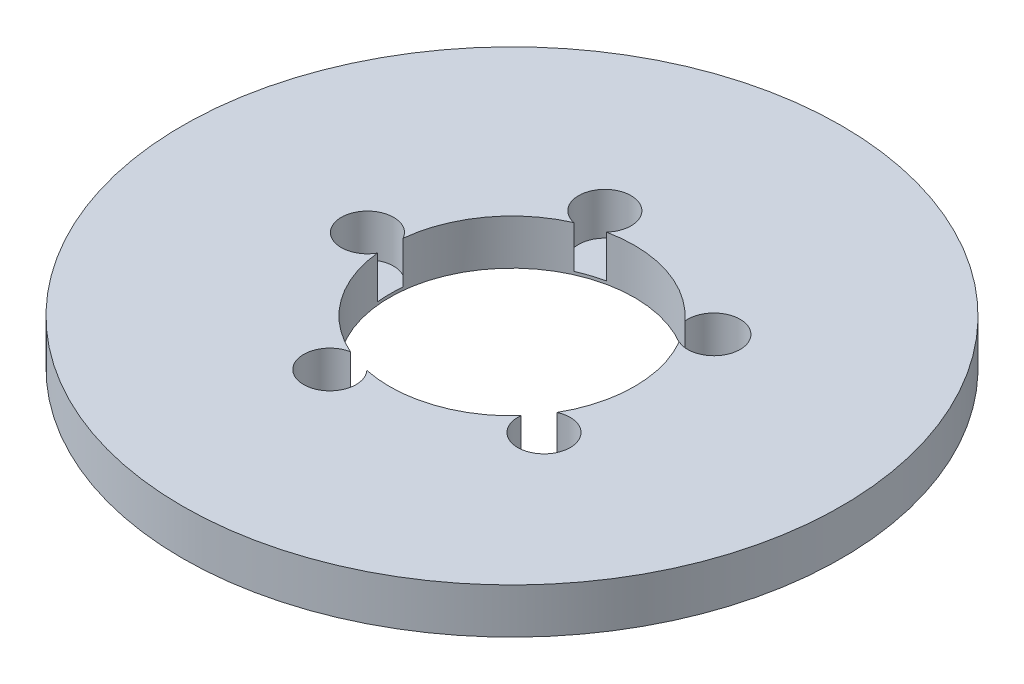
from build123d import *

# Parameters (mm, degrees)
SKETCH1_R           = 87.5
BOSS_EXTRUDE1_DEPTH = 12
SKETCH2_R           = 32.5
CUT_EXTRUDE1_DEPTH  = 125.324173032
SKETCH3_R           = 6.96053116
CUT_EXTRUDE2_DEPTH  = 11.22869187
CIRPATTERN1_COUNT   = 5


with BuildPart() as part:
    # Sketch1 → Boss-Extrude1 (new body)
    with BuildSketch(Plane(origin=(0, 0, 0), x_dir=(1, 0, 0), z_dir=(0, 1, 0))):
        Circle(SKETCH1_R)
    extrude(amount=BOSS_EXTRUDE1_DEPTH)

    # Sketch2 → Cut-Extrude1 (cut, through all)
    with BuildSketch(Plane(origin=(0, 0, 0), x_dir=(1, 0, 0), z_dir=(0, 1, 0))):
        Circle(SKETCH2_R)
    extrude(amount=CUT_EXTRUDE1_DEPTH, mode=Mode.SUBTRACT)

    # Sketch3 → Cut-Extrude2 (cut)
    with BuildSketch(Plane(origin=(0, 12, 0), x_dir=(1, 0, 0), z_dir=(0, 1, 0))):
        with Locations((-38.380672044, 0)):
            Circle(SKETCH3_R)
    cut_extrude2 = extrude(amount=-CUT_EXTRUDE2_DEPTH, mode=Mode.SUBTRACT)

    # CirPattern1: Cut-Extrude2 ×5 about axis
    cirpattern1_axis = Axis((0, 0, 0), (0, 1, 0))
    for i in range(1, CIRPATTERN1_COUNT):
        add(cut_extrude2.rotate(cirpattern1_axis, i * 360 / CIRPATTERN1_COUNT), mode=Mode.SUBTRACT)


solid = part.part
